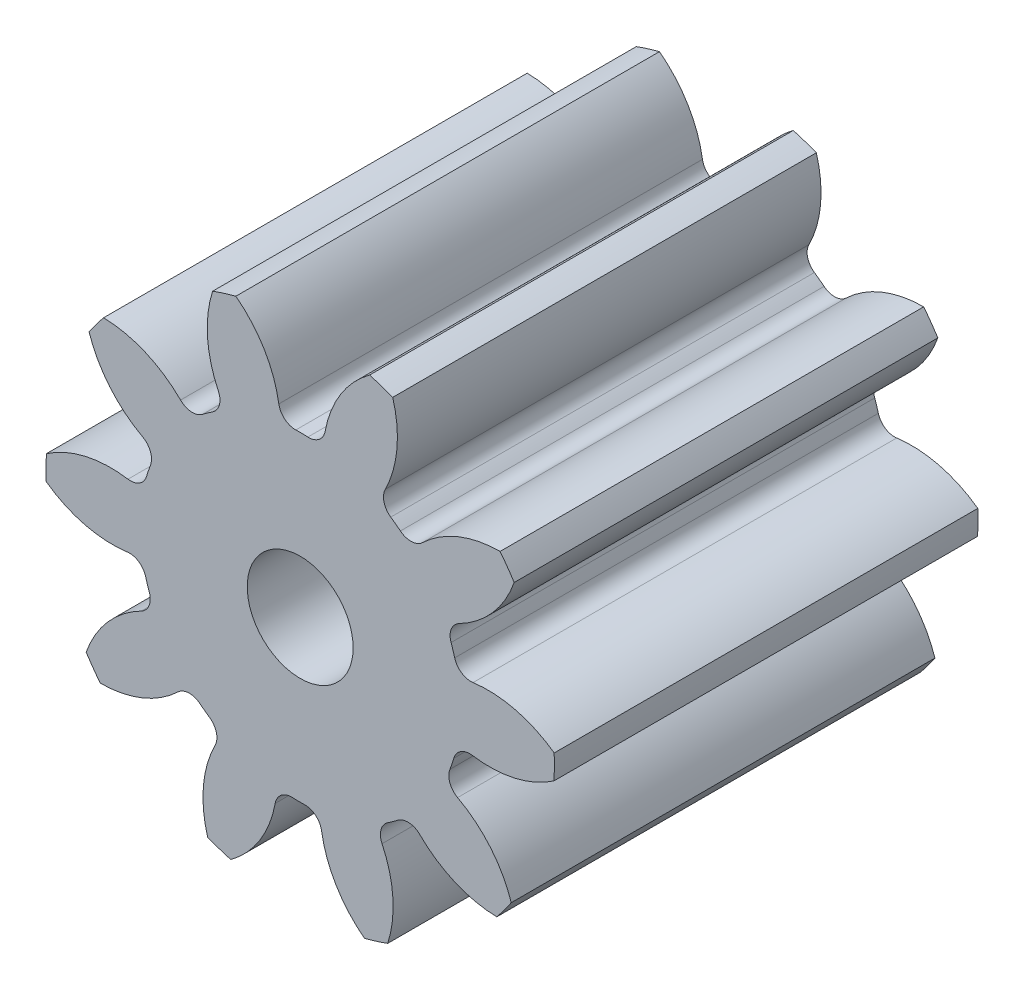
from build123d import *

# Parameters (mm, degrees)
SKETCH3_R         = 15.24
GEARBODY_DEPTH    = 25.4
TOOTHCUT_DEPTH    = 34.311787703
CIRPATTERN1_COUNT = 10
BOREDIA_R         = 3.175
BORE_DEPTH        = 12700


with BuildPart() as part:
    # Sketch3 → gearBody (new body)
    with BuildSketch(Plane.XY):
        Circle(SKETCH3_R)
    extrude(amount=GEARBODY_DEPTH)

    # Sketch2 → toothCut (cut, through all)
    with BuildSketch(Plane.XY):
        with BuildLine():
            ThreePointArc((8.978148959, -3.402334891), (9.099733091, -3.062335565), (9.208446704, -2.718004919))
            ThreePointArc((9.208446704, -2.718004919), (9.633677899, -2.154183003), (10.324904213, -2.009535477))
            ThreePointArc((10.324904213, -2.009535477), (14.577189645, -1.27852495), (17.531773304, 1.865794244))
            ThreePointArc((17.531773304, 1.865794244), (16.709927513, -5.623396291), (12.836674632, -12.085695996))
            ThreePointArc((12.836674632, -12.085695996), (12.384259618, -7.794818645), (9.439116174, -4.64165549))
            ThreePointArc((9.439116174, -4.64165549), (8.975980875, -4.108530348), (8.978148959, -3.402334891))
        make_face()
    toothcut = extrude(amount=TOOTHCUT_DEPTH, mode=Mode.SUBTRACT)

    # CirPattern1: toothCut ×10 about axis
    cirpattern1_axis = Axis((0, 0, 25.4), (0, 0, -1))
    for i in range(1, CIRPATTERN1_COUNT):
        add(toothcut.rotate(cirpattern1_axis, i * 360 / CIRPATTERN1_COUNT), mode=Mode.SUBTRACT)

    # boreDia → bore (cut, symmetric)
    with BuildSketch(Plane.XY):
        Circle(BOREDIA_R)
    extrude(amount=BORE_DEPTH, both=True, mode=Mode.SUBTRACT)


solid = part.part
